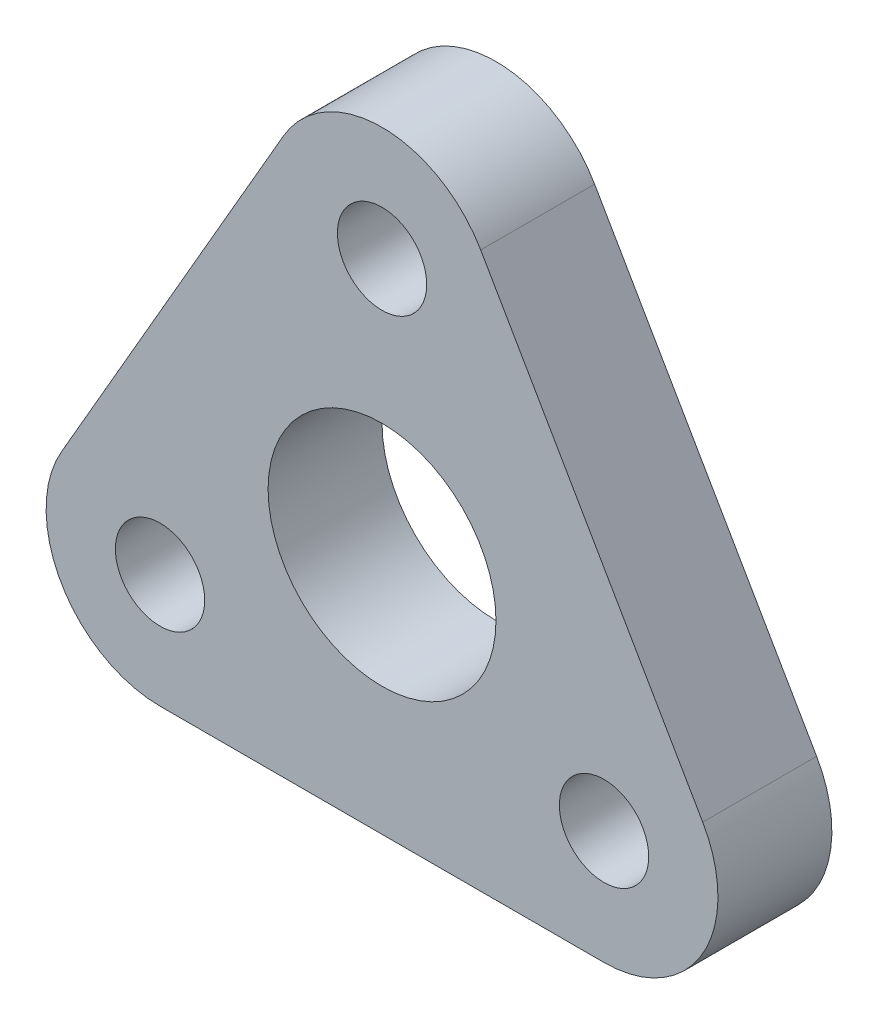
from build123d import *

# Parameters (mm, degrees)
SKETCH1_R           = 6.35
SKETCH1_R_2         = 2.4892
BOSS_EXTRUDE1_DEPTH = 6.35
FILLET1_R           = 6.35


with BuildPart() as part:
    # Sketch1 → Boss-Extrude1 (new body)
    with BuildSketch(Plane.XY):
        Polygon((0, 26.9875), (23.371860585, -13.49375), (-23.371860585, -13.49375), align=None)
        Circle(SKETCH1_R, mode=Mode.SUBTRACT)
        with Locations((0, 14.2875)):
            Circle(SKETCH1_R_2, mode=Mode.SUBTRACT)
        with Locations((12.373337957, -7.14375)):
            Circle(SKETCH1_R_2, mode=Mode.SUBTRACT)
        with Locations((-12.373337957, -7.14375)):
            Circle(SKETCH1_R_2, mode=Mode.SUBTRACT)
    extrude(amount=BOSS_EXTRUDE1_DEPTH)

    # Fillet1
    fillet1_edges = [part.edges().sort_by_distance(p)[0] for p in [
        (23.371860585, -13.49375, 3.175),
        (-23.371860585, -13.49375, 3.175),
        (0, 26.9875, 3.175),
    ]]
    fillet(fillet1_edges, radius=FILLET1_R)


solid = part.part
